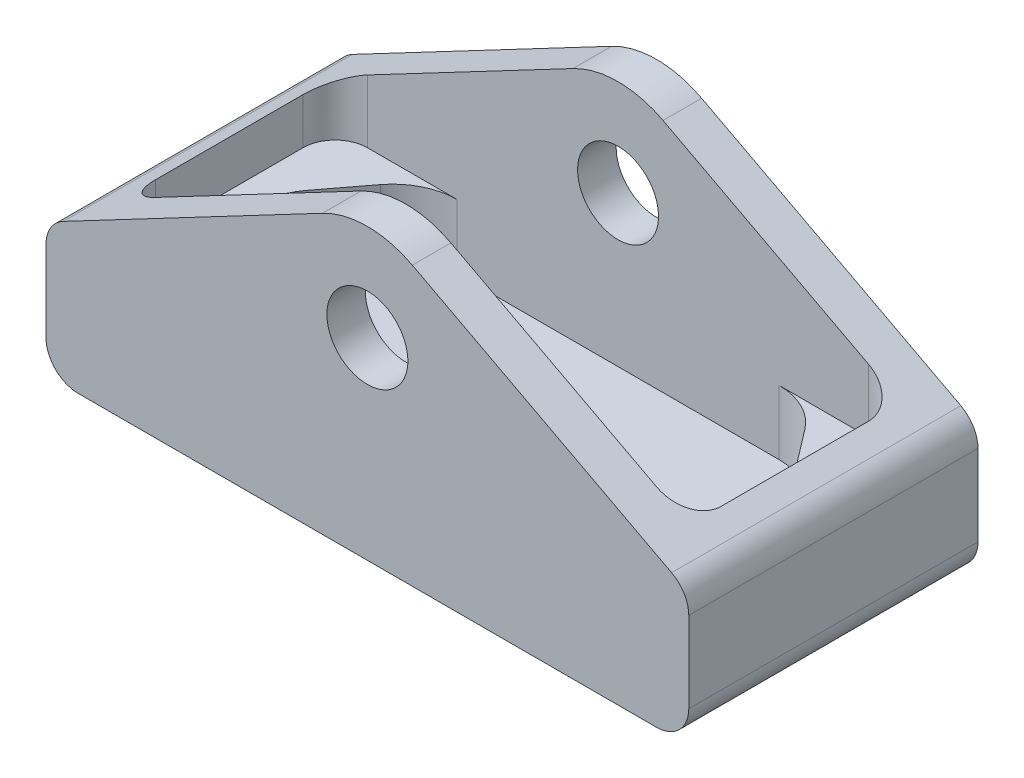
from build123d import *
from OCP.BRepAlgoAPI import BRepAlgoAPI_Cut
from OCP.TopTools import TopTools_ListOfShape

# Parameters (mm, degrees)
SKETCH1_R              = 3
BOSS_EXTRUDE1_DEPTH    = 28.575
CUT_EXTRUDE1_DEPTH     = 18.034
CUT_EXTRUDE4_DEPTH     = 6.35
CUT_EXTRUDE5_START     = -28.575
CUT_EXTRUDE5_OUTLINE_R = 4
CUT_EXTRUDE5_DEPTH     = 28.575


with BuildPart() as part:
    # Sketch1 → Boss-Extrude1 (new body)
    with BuildSketch(Plane(origin=(0, 0, 0), x_dir=(1, 0, 0), z_dir=(0, 1, 0))):
        Polygon((0, 6.35), (0, 22.225), (0, 28.575), (6.35, 28.575), (57.15, 28.575), (63.5, 28.575), (63.5, 22.225), (63.5, 6.35), (63.5, 0), (57.15, 0), (6.35, 0), (0, 0), align=None)
        with Locations(Location((12.7, 14.2875, 0), (0, 0, 270))):
            Circle(SKETCH1_R, mode=Mode.SUBTRACT)
        with Locations(Location((50.8, 14.2875, 0), (0, 0, 270))):
            Circle(SKETCH1_R, mode=Mode.SUBTRACT)
    extrude(amount=-BOSS_EXTRUDE1_DEPTH)

    # Sketch2 → Cut-Extrude1 (cut)
    with BuildSketch(Plane(origin=(0, 0, 0), x_dir=(1, 0, 0), z_dir=(0, 1, 0))):
        with BuildLine():
            Line((6.985, 24.765), (56.515, 24.765))
            ThreePointArc((56.515, 24.765), (58.76006403, 23.83506403), (59.69, 21.59))
            Line((59.69, 21.59), (59.69, 6.985))
            ThreePointArc((59.69, 6.985), (58.76006403, 4.73993597), (56.515, 3.81))
            Line((56.515, 3.81), (6.985, 3.81))
            ThreePointArc((6.985, 3.81), (4.73993597, 4.73993597), (3.81, 6.985))
            Line((3.81, 6.985), (3.81, 21.59))
            ThreePointArc((3.81, 21.59), (4.73993597, 23.83506403), (6.985, 24.765))
        make_face()
    extrude(amount=-CUT_EXTRUDE1_DEPTH, mode=Mode.SUBTRACT)

    # Sketch4 → Cut-Extrude4 (cut)
    with BuildSketch(Plane(origin=(0, -18.034, 0), x_dir=(1, 0, 0), z_dir=(0, 1, 0))):
        with BuildLine():
            Line((55.850907282, 18.135984848), (52.706002748, 22.263484848))
            ThreePointArc((52.706002748, 22.263484848), (50.473305999, 24.105359338), (47.655095466, 24.765))
            Line((47.655095466, 24.765), (15.844904534, 24.765))
            ThreePointArc((15.844904534, 24.765), (13.026694001, 24.105359338), (10.793997252, 22.263484848))
            Line((10.793997252, 22.263484848), (7.649092718, 18.135984848))
            ThreePointArc((7.649092718, 18.135984848), (6.35, 14.2875), (7.649092718, 10.439015152))
            Line((7.649092718, 10.439015152), (10.793997252, 6.311515152))
            ThreePointArc((10.793997252, 6.311515152), (13.026694001, 4.469640662), (15.844904534, 3.81))
            Line((15.844904534, 3.81), (47.655095466, 3.81))
            ThreePointArc((47.655095466, 3.81), (50.473305999, 4.469640662), (52.706002748, 6.311515152))
            Line((52.706002748, 6.311515152), (55.850907282, 10.439015152))
            ThreePointArc((55.850907282, 10.439015152), (57.15, 14.2875), (55.850907282, 18.135984848))
        make_face()
    extrude(amount=-CUT_EXTRUDE4_DEPTH, mode=Mode.SUBTRACT)


with BuildPart() as cut_extrude5_tool:
    # Cut-Extrude5: read off the stored shape, not the designer's step
    # Cut-Extrude5 outline → Cut-Extrude5 (new body)
    with BuildSketch(Plane(origin=(0, 0, -28.575), x_dir=(-1, 0, 0), z_dir=(0, 0, -1)).offset(CUT_EXTRUDE5_START)):
        with BuildLine():
            ThreePointArc((-31.75, 4.067e-06), (-29.462231849, -0.278821364), (-27.308403366, -1.098973545))
            Line((-27.308403366, -1.098973545), (-1.694470317, -14.600801413))
            ThreePointArc((-1.694470317, -14.600801413), (-0.456425728, -15.769363319), (-1.896e-06, -17.409475699))
            Line((-1.896e-06, -17.409475699), (0, 0))
            Line((0, 0), (-31.75, 4.067e-06))
        make_face()
        with BuildLine():
            ThreePointArc((-36.191594414, -1.098972375), (-34.037766933, -0.278821063), (-31.75, 4.067e-06))
            Line((-31.75, 4.067e-06), (-63.5, 0))
            Line((-63.5, 0), (-63.500001896, -17.409469074))
            ThreePointArc((-63.500001896, -17.409469074), (-63.043577848, -15.769356336), (-61.805532735, -14.600794399))
            Line((-61.805532735, -14.600794399), (-36.191594414, -1.098972375))
        make_face()
        with BuildLine():
            Line((0, -28.575), (-1.896e-06, -25.399996402))
            ThreePointArc((-1.896e-06, -25.399996402), (-0.929937865, -27.645060432), (-3.175001896, -28.574996402))
            Line((-3.175001896, -28.574996402), (0, -28.575))
        make_face()
        with BuildLine():
            ThreePointArc((-60.325001896, -28.574996402), (-62.570065927, -27.645060433), (-63.500001896, -25.399996402))
            Line((-63.500001896, -25.399996402), (-63.5, -28.575))
            Line((-63.5, -28.575), (-60.325001896, -28.574996402))
        make_face()
        with Locations((-31.75, -9.525)):
            Circle(CUT_EXTRUDE5_OUTLINE_R)
    extrude(amount=CUT_EXTRUDE5_DEPTH)


with BuildPart() as part_1:
    add(part.part)

    # Cut-Extrude5: cut by cut_extrude5_tool, with a tolerance
    cut_extrude5_stock = TopTools_ListOfShape()
    cut_extrude5_stock.Append(part_1.part.wrapped)
    cut_extrude5_tools = TopTools_ListOfShape()
    cut_extrude5_tools.Append(cut_extrude5_tool.part.wrapped)
    cut_extrude5_cut = BRepAlgoAPI_Cut()
    cut_extrude5_cut.SetArguments(cut_extrude5_stock)
    cut_extrude5_cut.SetTools(cut_extrude5_tools)
    cut_extrude5_cut.SetFuzzyValue(0.00001)
    cut_extrude5_cut.Build()
    add(Compound.cast(cut_extrude5_cut.Shape()).solids(), mode=Mode.REPLACE)


solid = part_1.part
